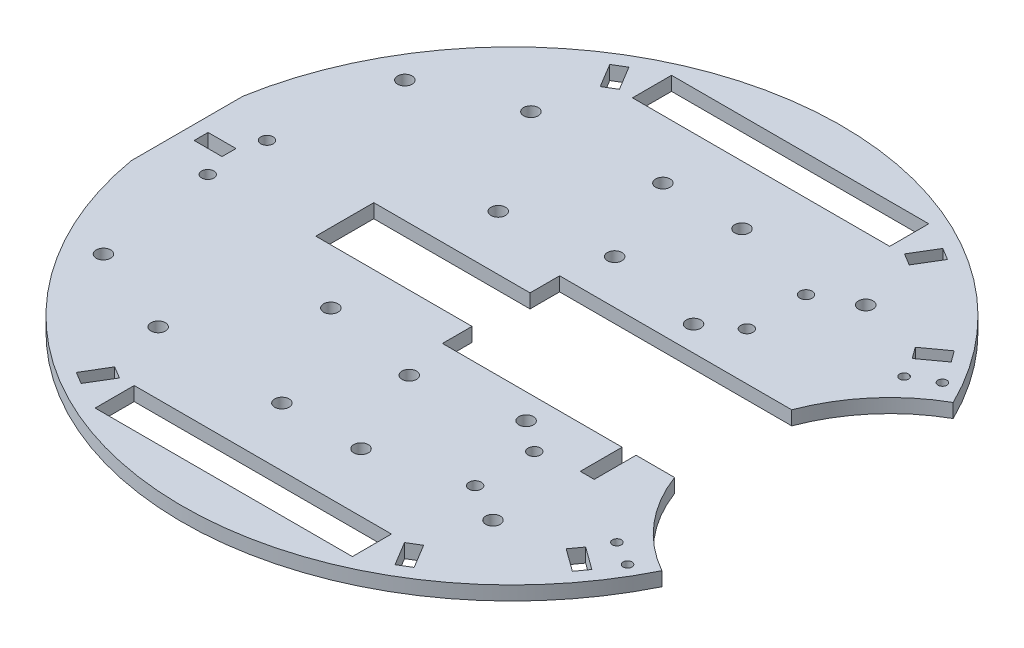
from build123d import *

# Parameters (mm, degrees)
SKETCH1_R           = 1.397
SKETCH1_R_2         = 1.651
SKETCH1_R_3         = 1.016
SKETCH1_W           = 58.544107304
SKETCH1_H           = 8.89
SKETCH1_W_2         = 6.35
SKETCH1_H_2         = 3.175
BOSS_EXTRUDE1_DEPTH = 3.175


with BuildPart() as part:
    # Sketch1 → Boss-Extrude1 (new body)
    with BuildSketch(Plane(origin=(0, 0, 0), x_dir=(1, 0, 0), z_dir=(0, 1, 0))):
        with BuildLine():
            Line((38.407265908, 13.335), (41.582265908, 13.335))
            Line((41.582265908, 13.335), (50.342102347, 13.335))
            ThreePointArc((50.342102347, 13.335), (57.058059725, 24.74076345), (67.270928268, 33.160552015))
            ThreePointArc((67.270928268, 33.160552015), (-10.756431789, 74.224653419), (-73.916912814, 12.7))
            Line((-73.916912814, 12.7), (-73.916912814, -12.7))
            ThreePointArc((-73.916912814, -12.7), (-10.756431789, -74.224653419), (67.270928268, -33.160552015))
            ThreePointArc((67.270928268, -33.160552015), (60.584216496, -28.355013333), (55.086193863, -22.225))
            ThreePointArc((55.086193863, -22.225), (52.41895011, -17.937530518), (50.342102347, -13.335))
            Line((50.342102347, -13.335), (46.281265908, -13.335))
            Line((46.281265908, -13.335), (41.582265908, -13.335))
            Line((41.582265908, -13.335), (41.582265908, -22.86))
            Line((41.582265908, -22.86), (38.407265908, -22.86))
            Line((38.407265908, -22.86), (38.407265908, -13.335))
            Line((38.407265908, -13.335), (-2.486734092, -13.335))
            Line((-2.486734092, -13.335), (-2.486734092, -6.604))
            Line((-2.486734092, -6.604), (-38.046734092, -6.604))
            Line((-38.046734092, -6.604), (-38.046734092, 6.604))
            Line((-38.046734092, 6.604), (-2.486734092, 6.604))
            Line((-2.486734092, 6.604), (-2.486734092, 13.335))
            Line((-2.486734092, 13.335), (38.407265908, 13.335))
        make_face()
        with Locations((-62.486912814, 6.731)):
            Circle(SKETCH1_R, mode=Mode.SUBTRACT)
        with Locations((-62.486912814, -6.731)):
            Circle(SKETCH1_R, mode=Mode.SUBTRACT)
        with Locations((-38.1, -42.418)):
            Circle(SKETCH1_R_2, mode=Mode.SUBTRACT)
        with Locations((38.1, -42.418)):
            Circle(SKETCH1_R_2, mode=Mode.SUBTRACT)
        with Locations((38.1, 42.418)):
            Circle(SKETCH1_R_2, mode=Mode.SUBTRACT)
        with Locations((0, -23.368)):
            Circle(SKETCH1_R_2, mode=Mode.SUBTRACT)
        with Locations((-38.1, 42.418)):
            Circle(SKETCH1_R_2, mode=Mode.SUBTRACT)
        with Locations((0, 23.368)):
            Circle(SKETCH1_R_2, mode=Mode.SUBTRACT)
        with Locations((29.272053652, -37.649461806)):
            Circle(SKETCH1_R, mode=Mode.SUBTRACT)
        with Locations((-58.676912814, 34.29)):
            Circle(SKETCH1_R_2, mode=Mode.SUBTRACT)
        with Locations((62.141053559, -35.830642926)):
            Circle(SKETCH1_R_3, mode=Mode.SUBTRACT)
        with Locations((56.570777105, -32.679132142)):
            Circle(SKETCH1_R_3, mode=Mode.SUBTRACT)
        with Locations((-58.676912814, -34.29)):
            Circle(SKETCH1_R_2, mode=Mode.SUBTRACT)
        with Locations((29.272053652, -24.187461806)):
            Circle(SKETCH1_R, mode=Mode.SUBTRACT)
        with Locations((29.272053652, 37.649461806)):
            Circle(SKETCH1_R, mode=Mode.SUBTRACT)
        with Locations((29.272053652, 24.187461806)):
            Circle(SKETCH1_R, mode=Mode.SUBTRACT)
        with Locations((8.99925, -43.353461806)):
            Circle(SKETCH1_R_2, mode=Mode.SUBTRACT)
        with Locations((-9.00075, -43.353461806)):
            Circle(SKETCH1_R_2, mode=Mode.SUBTRACT)
        with Locations((-9.00075, 43.353461806)):
            Circle(SKETCH1_R_2, mode=Mode.SUBTRACT)
        with Locations((8.99925, 43.353461806)):
            Circle(SKETCH1_R_2, mode=Mode.SUBTRACT)
        with Locations((62.141053559, 35.830642926)):
            Circle(SKETCH1_R_3, mode=Mode.SUBTRACT)
        with Locations((56.570777105, 32.679132142)):
            Circle(SKETCH1_R_3, mode=Mode.SUBTRACT)
        with Locations((22.278265908, 19.05)):
            Circle(SKETCH1_R_2, mode=Mode.SUBTRACT)
        with Locations((22.278265908, -19.05)):
            Circle(SKETCH1_R_2, mode=Mode.SUBTRACT)
        with Locations((-22.171734092, -19.05)):
            Circle(SKETCH1_R_2, mode=Mode.SUBTRACT)
        with Locations((-22.171734092, 19.05)):
            Circle(SKETCH1_R_2, mode=Mode.SUBTRACT)
        with Locations((0, -61.144461806)):
            Rectangle(SKETCH1_W, SKETCH1_H, mode=Mode.SUBTRACT)
        with Locations((0, 61.144461806)):
            Rectangle(SKETCH1_W, SKETCH1_H, mode=Mode.SUBTRACT)
        Polygon((52.069010519, 39.727999256), (57.209246442, 43.456333288), (59.073413458, 40.886215326), (53.933177535, 37.157881294), align=None, mode=Mode.SUBTRACT)
        Polygon((53.933177535, -37.157881294), (59.073413458, -40.886215326), (57.209246442, -43.456333288), (52.069010519, -39.727999256), align=None, mode=Mode.SUBTRACT)
        Polygon((32.44100721, -56.895314679), (35.719111901, -62.333745485), (38.438327304, -60.694693139), (35.160222613, -55.256262334), align=None, mode=Mode.SUBTRACT)
        Polygon((-32.44100721, -56.895314679), (-35.160222613, -55.256262334), (-38.438327304, -60.694693139), (-35.719111901, -62.333745485), align=None, mode=Mode.SUBTRACT)
        Polygon((-35.160222613, 55.256262334), (-38.438327304, 60.694693139), (-35.719111901, 62.333745485), (-32.44100721, 56.895314679), align=None, mode=Mode.SUBTRACT)
        Polygon((35.160222613, 55.256262334), (38.438327304, 60.694693139), (35.719111901, 62.333745485), (32.44100721, 56.895314679), align=None, mode=Mode.SUBTRACT)
        with Locations((-67.566912814, 0)):
            Rectangle(SKETCH1_W_2, SKETCH1_H_2, mode=Mode.SUBTRACT)
    extrude(amount=BOSS_EXTRUDE1_DEPTH)


solid = part.part
